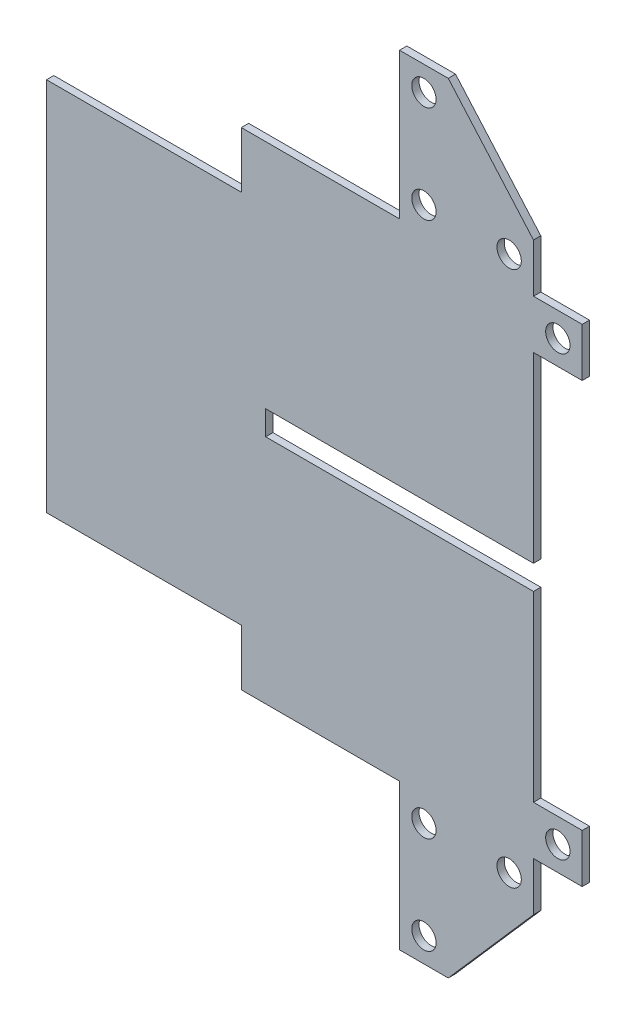
from build123d import *

# Parameters (mm, degrees)
ESQUISSE1_R        = 5
BOSS_EXTRU_1_DEPTH = 3


with BuildPart() as part:
    # Esquisse1 → Boss.-Extru.1 (new body)
    with BuildSketch(Plane.XY):
        Polygon((80, 77), (0, 77), (0, 0), (90, 0), (90, 5), (200, 5), (200, 80), (220, 80), (220, 100), (200, 100), (200, 120), (165, 160), (145, 160), (145, 100), (80, 100), align=None)
        with Locations((155, 150)):
            Circle(ESQUISSE1_R, mode=Mode.SUBTRACT)
        with Locations((155, 110)):
            Circle(ESQUISSE1_R, mode=Mode.SUBTRACT)
        with Locations((190, 110)):
            Circle(ESQUISSE1_R, mode=Mode.SUBTRACT)
        with Locations((210, 90)):
            Circle(ESQUISSE1_R, mode=Mode.SUBTRACT)
    boss_extru_1 = extrude(amount=BOSS_EXTRU_1_DEPTH)

    # Symétrie1: Boss.-Extru.1 across plane
    add(boss_extru_1.mirror(Plane(origin=(0, 0, 3), x_dir=(0, 0, 1), z_dir=(0, 1, 0))))


solid = part.part
